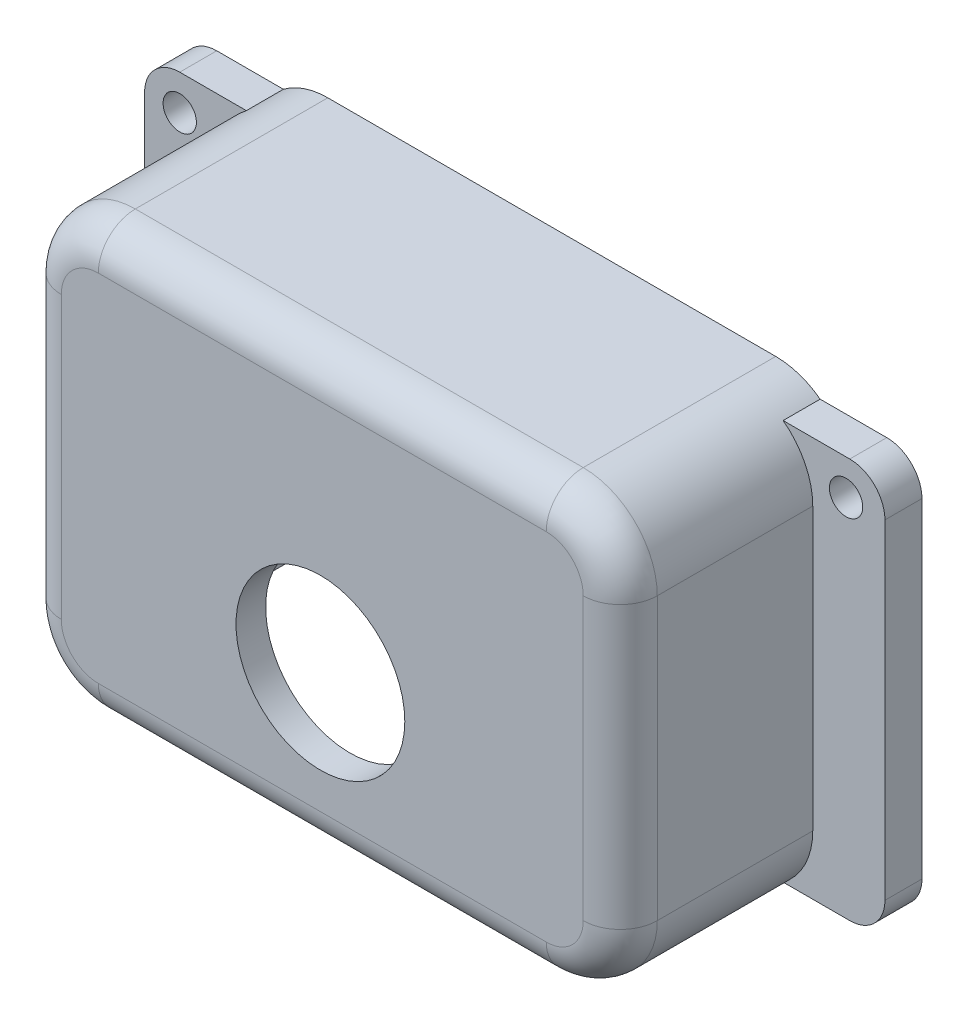
from build123d import *

# Parameters (mm, degrees)
CROQUIS1_R              = 2.25
CROQUIS1_W              = 70.5
CROQUIS1_H              = 48
SALIENTE_EXTRUIR1_DEPTH = 5
CROQUIS1_3_W            = 80.5
CROQUIS1_3_H            = 2
CROQUIS1_3_H_2          = 54
CROQUIS1_3_W_2          = 70.5
CROQUIS1_3_H_3          = 48
SALIENTE_EXTRUIR2_DEPTH = 31
CROQUIS1_5_W            = 70.5
CROQUIS1_5_H            = 48
CORTAR_EXTRUIR2_DEPTH   = 27
REDONDEO4_R             = 5
REDONDEO5_START         = 5
REDONDEO5_DEPTH         = 26
REDONDEO5_START_2       = -1
REDONDEO5_2_DEPTH       = 8.65388
REDONDEO5_3_ANGLE       = 90
REDONDEO5_4_ANGLE       = 90
REDONDEO5_5_ANGLE       = 90
REDONDEO5_6_ANGLE       = 90
CROQUIS3_W              = 70.5
CROQUIS3_H              = 27
CORTAR_EXTRUIR5_DEPTH   = 80.183331618
CROQUIS4_R              = 11.399999943
CORTAR_EXTRUIR6_DEPTH   = 10


with BuildPart() as part:
    # Croquis1 → Saliente-Extruir1 (new body)
    with BuildSketch(Plane.XY):
        with BuildLine():
            Line((-45.25, 27), (45.25, 27))
            ThreePointArc((45.25, 27), (48.608757211, 25.608757211), (50, 22.25))
            Line((50, 22.25), (50, -22.25))
            ThreePointArc((50, -22.25), (48.608757211, -25.608757211), (45.25, -27))
            Line((45.25, -27), (-45.25, -27))
            ThreePointArc((-45.25, -27), (-48.608757211, -25.608757211), (-50, -22.25))
            Line((-50, -22.25), (-50, 22.25))
            ThreePointArc((-50, 22.25), (-48.608757211, 25.608757211), (-45.25, 27))
        make_face()
        with Locations((-45.25, 22.25)):
            Circle(CROQUIS1_R, mode=Mode.SUBTRACT)
        with Locations((44.75000048, 22.250001182)):
            Circle(CROQUIS1_R, mode=Mode.SUBTRACT)
        Rectangle(CROQUIS1_W, CROQUIS1_H, mode=Mode.SUBTRACT)
    extrude(amount=SALIENTE_EXTRUIR1_DEPTH)

    # Croquis1<3> → Saliente-Extruir2 (add)
    # profile 1 of 4: a face of its own
    with BuildSketch(Plane.XY):
        with Locations((0, 28)):
            Rectangle(CROQUIS1_3_W, CROQUIS1_3_H)
    # profile 2 of 4: a face of its own
    with BuildSketch(Plane.XY):
        Rectangle(CROQUIS1_3_W, CROQUIS1_3_H_2)
        Rectangle(CROQUIS1_3_W_2, CROQUIS1_3_H_3, mode=Mode.SUBTRACT)
    # profile 3 of 4: a face of its own
    with BuildSketch(Plane.XY):
        Rectangle(CROQUIS1_3_W_2, CROQUIS1_3_H_3)
    # profile 4 of 4: a face of its own
    with BuildSketch(Plane.XY):
        with Locations((0, -28)):
            Rectangle(CROQUIS1_3_W, CROQUIS1_3_H)
    extrude(amount=SALIENTE_EXTRUIR2_DEPTH)

    # Croquis1<5> → Cortar-Extruir2 (cut)
    with BuildSketch(Plane.XY):
        Rectangle(CROQUIS1_5_W, CROQUIS1_5_H)
    extrude(amount=CORTAR_EXTRUIR2_DEPTH, mode=Mode.SUBTRACT)

    # Redondeo4
    redondeo4_edges = [part.edges().sort_by_distance(p)[0] for p in [
        (40.25, 0, 31),
        (0, 29, 31),
        (-40.25, 0, 31),
        (0, -29, 31),
    ]]
    fillet(redondeo4_edges, radius=REDONDEO4_R)

    # Redondeo5: read off the stored shape, not the designer's step
    # Redondeo5 outline → Redondeo5 (cut)
    with BuildSketch(Plane.XY.offset(REDONDEO5_START)):
        with BuildLine():
            ThreePointArc((-40.25, 19), (-37.321067812, 26.071067812), (-30.25, 29))
            Line((-30.25, 29), (-40.25, 29))
            Line((-40.25, 29), (-40.25, 19))
        make_face()
        with BuildLine():
            Line((40.25, 29), (30.25, 29))
            ThreePointArc((30.25, 29), (37.321067812, 26.071067812), (40.25, 19))
            Line((40.25, 19), (40.25, 29))
        make_face()
        with BuildLine():
            Line((-40.25, -19), (-40.25, -29))
            Line((-40.25, -29), (-30.25, -29))
            ThreePointArc((-30.25, -29), (-37.321067812, -26.071067812), (-40.25, -19))
        make_face()
        with BuildLine():
            ThreePointArc((40.25, -19), (37.321067812, -26.071067812), (30.25, -29))
            Line((30.25, -29), (40.25, -29))
            Line((40.25, -29), (40.25, -19))
        make_face()
    extrude(amount=REDONDEO5_DEPTH, mode=Mode.SUBTRACT)

    # Redondeo5 2 outline → Redondeo5 2 (cut)
    with BuildSketch(Plane.XY.offset(REDONDEO5_START_2)):
        with BuildLine():
            Line((-40.25, 27), (-36.25, 27))
            ThreePointArc((-36.25, 27), (-33.41227766, 28.486832981), (-30.25, 29))
            Line((-30.25, 29), (-40.25, 29))
            Line((-40.25, 29), (-40.25, 27))
        make_face()
        with BuildLine():
            Line((40.25, 29), (30.25, 29))
            ThreePointArc((30.25, 29), (33.41227766, 28.486832981), (36.25, 27))
            Line((36.25, 27), (40.25, 27))
            Line((40.25, 27), (40.25, 29))
        make_face()
        with BuildLine():
            ThreePointArc((-30.25, -29), (-33.41227766, -28.486832981), (-36.25, -27))
            Line((-36.25, -27), (-40.25, -27))
            Line((-40.25, -27), (-40.25, -29))
            Line((-40.25, -29), (-30.25, -29))
        make_face()
        with BuildLine():
            ThreePointArc((36.25, -27), (33.41227766, -28.486832981), (30.25, -29))
            Line((30.25, -29), (40.25, -29))
            Line((40.25, -29), (40.25, -27))
            Line((40.25, -27), (36.25, -27))
        make_face()
    extrude(amount=REDONDEO5_2_DEPTH, mode=Mode.SUBTRACT)

    # Redondeo5 3 outline → Redondeo5 3 (revolve, cut)
    with BuildSketch(Plane(origin=(30.25, 19, 0), x_dir=(1, 0, 0), z_dir=(0, -1, 0))):
        with BuildLine():
            ThreePointArc((5, 31), (8.535533906, 29.535533906), (10, 26))
            Line((10, 26), (10, 31))
            Line((10, 31), (5, 31))
        make_face()
    revolve(axis=Axis((30.25, 19, 0), (0, 0, 1)), revolution_arc=REDONDEO5_3_ANGLE, mode=Mode.SUBTRACT)

    # Redondeo5 4 outline → Redondeo5 4 (revolve, cut)
    with BuildSketch(Plane(origin=(-30.25, 19, 0), x_dir=(0, 1, 0), z_dir=(1, 0, 0))):
        with BuildLine():
            ThreePointArc((5, 31), (8.535533906, 29.535533906), (10, 26))
            Line((10, 26), (10, 31))
            Line((10, 31), (5, 31))
        make_face()
    revolve(axis=Axis((-30.25, 19, 0), (0, 0, 1)), revolution_arc=REDONDEO5_4_ANGLE, mode=Mode.SUBTRACT)

    # Redondeo5 5 outline → Redondeo5 5 (revolve, cut)
    with BuildSketch(Plane(origin=(-30.25, -19, 0), x_dir=(-1, 0, 0), z_dir=(0, 1, 0))):
        with BuildLine():
            ThreePointArc((5, 31), (8.535533906, 29.535533906), (10, 26))
            Line((10, 26), (10, 31))
            Line((10, 31), (5, 31))
        make_face()
    revolve(axis=Axis((-30.25, -19, 0), (0, 0, 1)), revolution_arc=REDONDEO5_5_ANGLE, mode=Mode.SUBTRACT)

    # Redondeo5 6 outline → Redondeo5 6 (revolve, cut)
    with BuildSketch(Plane(origin=(30.25, -19, 0), x_dir=(0, -1, 0), z_dir=(-1, 0, 0))):
        with BuildLine():
            ThreePointArc((5, 31), (8.535533906, 29.535533906), (10, 26))
            Line((10, 26), (10, 31))
            Line((10, 31), (5, 31))
        make_face()
    revolve(axis=Axis((30.25, -19, 0), (0, 0, 1)), revolution_arc=REDONDEO5_6_ANGLE, mode=Mode.SUBTRACT)

    # Croquis3 → Cortar-Extruir5 (cut, through all)
    with BuildSketch(Plane(origin=(0, -24, 0), x_dir=(1, 0, 0), z_dir=(0, 1, 0))):
        with Locations((0, -13.5)):
            Rectangle(CROQUIS3_W, CROQUIS3_H)
    extrude(amount=-CORTAR_EXTRUIR5_DEPTH, mode=Mode.SUBTRACT)

    # Croquis4 → Cortar-Extruir6 (cut)
    with BuildSketch(Plane.XY.offset(31)):
        with Locations((-0.24999952, -7.749998818)):
            Circle(CROQUIS4_R)
    extrude(amount=-CORTAR_EXTRUIR6_DEPTH, mode=Mode.SUBTRACT)


solid = part.part
